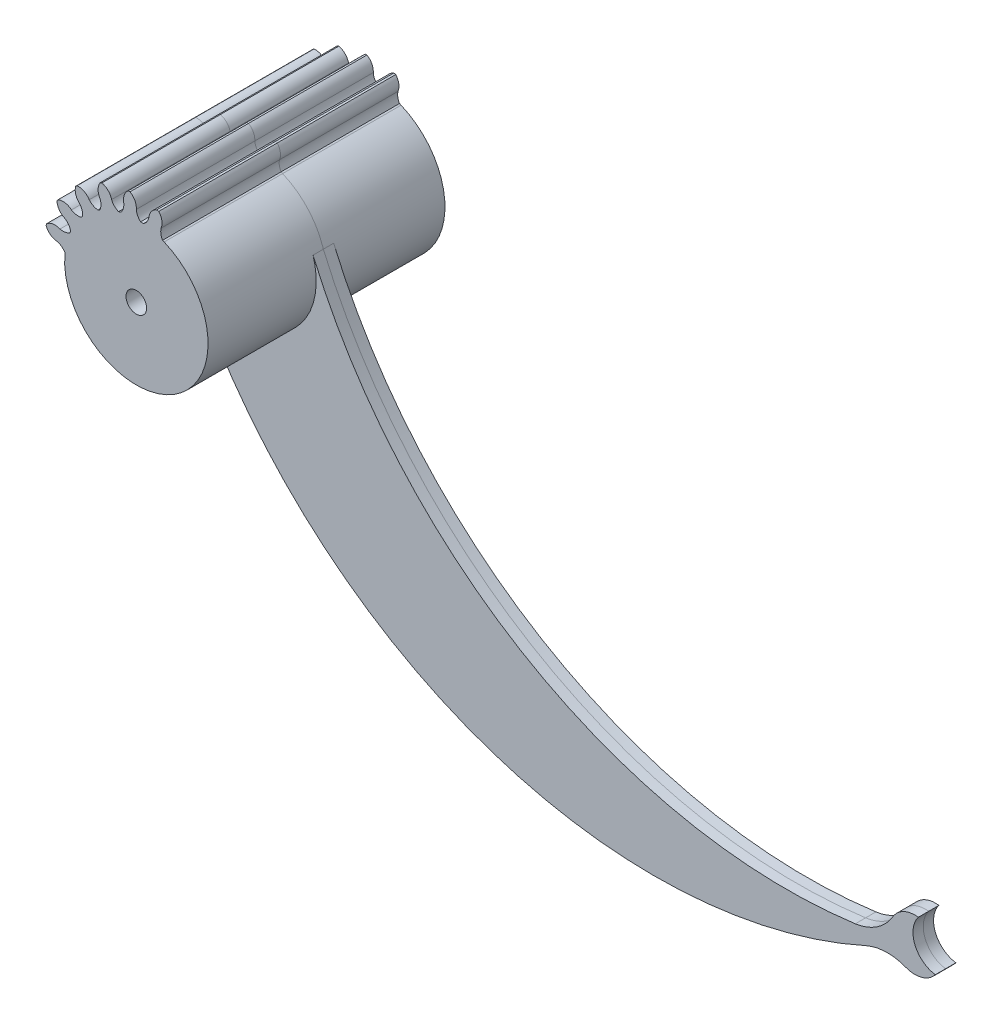
from build123d import *

# Parameters (mm, degrees)
ESQUISSE1_R             = 18
BOSS_EXTRU_1_DEPTH      = 23
ESQUISSE3_R             = 2
ENL_V_MAT_EXTRU_3_DEPTH = 35.307433597
BOSS_EXTRU_2_DEPTH      = 2
CONG_1_R                = 10
CONG_2_R                = 10


with BuildPart() as part:
    # Esquisse1 → Boss.-Extru.1 (new body)
    with BuildSketch(Plane.XY):
        Circle(ESQUISSE1_R)
    extrude(amount=-BOSS_EXTRU_1_DEPTH)

    # Esquisse3 → Enlèv. mat.-Extru.3 (cut, through all)
    with BuildSketch(Plane(origin=(0, 0, -23), x_dir=(-1, 0, 0), z_dir=(0, 0, -1))):
        with BuildLine():
            Line((-5.401914148, 12.832775649), (-5.100509092, 12.969438951))
            ThreePointArc((-5.100509092, 12.969438951), (-4.765685498, 13.881250232), (-4.803657598, 14.851850443))
            ThreePointArc((-4.803657598, 14.851850443), (-4.93702897, 16.32774427), (-4.211421318, 17.619852644))
            ThreePointArc((-4.211421318, 17.619852644), (-5.69322382, 17.602193117), (-6.904699682, 16.748743207))
            ThreePointArc((-6.904699682, 16.748743207), (-8.365662907, 16.50047527), (-9.429406277, 15.468728906))
            ThreePointArc((-9.429406277, 15.468728906), (-9.320405382, 15.468950409), (-9.211498437, 15.464420343))
            ThreePointArc((-9.211498437, 15.464420343), (-9.368945013, -15.369543563), (17.96620268, -1.102524947))
            ThreePointArc((17.96620268, -1.102524947), (18.020126749, -1.197253184), (18.069870351, -1.294241937))
            ThreePointArc((18.069870351, -1.294241937), (18.499584461, 0.123995101), (18.050898095, 1.536344583))
            ThreePointArc((18.050898095, 1.536344583), (18.254444436, 3.004206771), (17.591230084, 4.329422691))
            ThreePointArc((17.591230084, 4.329422691), (16.775166607, 3.092454254), (15.402187493, 2.534799463))
            ThreePointArc((15.402187493, 2.534799463), (14.540813003, 2.137466087), (13.889472301, 1.447832043))
            Line((13.889472301, 1.447832043), (13.889472301, 0.971270565))
            ThreePointArc((13.889472301, 0.971270565), (-7.29270091, -11.860747057), (-5.401914148, 12.832775649))
        make_face()
        with BuildLine():
            ThreePointArc((11.000443663, 11.074422202), (10.524374819, 10.215627293), (10.415766238, 9.239730569))
            ThreePointArc((10.415766238, 9.239730569), (10.462012349, 9.18733394), (10.507994882, 9.134705846))
            Line((10.507994882, 9.134705846), (10.731094032, 8.911606695))
            ThreePointArc((10.731094032, 8.911606695), (11.691932834, 8.886448288), (12.591250594, 9.225670511))
            ThreePointArc((12.591250594, 9.225670511), (13.950549833, 9.815887497), (15.405181444, 9.532872673))
            ThreePointArc((15.405181444, 9.532872673), (14.922963667, 10.934128013), (13.732171143, 11.816207192))
            ThreePointArc((13.732171143, 11.816207192), (13.037562859, 13.125241129), (11.723902757, 13.811060092))
            ThreePointArc((11.723902757, 13.811060092), (11.786796164, 12.33048759), (11.000443663, 11.074422202))
        make_face()
        with BuildLine():
            Line((12.765286048, 5.634000541), (12.874449055, 5.301826936))
            ThreePointArc((12.874449055, 5.301826936), (12.895585113, 5.250208748), (12.916514217, 5.198506303))
            ThreePointArc((12.916514217, 5.198506303), (13.838334104, 4.860248506), (14.81932063, 4.903093306))
            ThreePointArc((14.81932063, 4.903093306), (16.294287393, 5.046353769), (17.591230084, 4.329422691))
            ThreePointArc((17.591230084, 4.329422691), (17.563639265, 5.811073548), (16.702088682, 7.016802003))
            ThreePointArc((16.702088682, 7.016802003), (16.444034306, 8.476068412), (15.405181444, 9.532872673))
            ThreePointArc((15.405181444, 9.532872673), (15.009388539, 8.104797573), (13.874653946, 7.151682723))
            ThreePointArc((13.874653946, 7.151682723), (13.171881983, 6.501088333), (12.765286048, 5.634000541))
        make_face()
        with BuildLine():
            ThreePointArc((-2.431510322, 15.418830872), (-2.060789897, 14.584674949), (-1.415325051, 13.939210103))
            Line((-1.415325051, 13.939210103), (-0.828029009, 13.939210103))
            ThreePointArc((-0.828029009, 13.939210103), (-0.252520041, 14.694227343), (0, 15.609375))
            ThreePointArc((0, 15.609375), (0.327295419, 17.0546875), (1.415325051, 18.060789897))
            ThreePointArc((1.415325051, 18.060789897), (0, 18.5), (-1.415325051, 18.060789897))
            ThreePointArc((-1.415325051, 18.060789897), (-2.881790011, 18.274169922), (-4.211421318, 17.619852644))
            ThreePointArc((-4.211421318, 17.619852644), (-2.97995028, 16.795516793), (-2.431510322, 15.418830872))
        make_face()
        with BuildLine():
            ThreePointArc((9.141071212, 12.652802258), (10.252769067, 13.632689187), (11.723902757, 13.811060092))
            ThreePointArc((11.723902757, 13.811060092), (10.833862178, 14.995913787), (9.429406277, 15.468728906))
            ThreePointArc((9.429406277, 15.468728906), (8.365662907, 16.50047527), (6.904699682, 16.748743207))
            ThreePointArc((6.904699682, 16.748743207), (7.420174954, 15.359377971), (7.058528078, 13.922276009))
            ThreePointArc((7.058528078, 13.922276009), (6.869836592, 12.962423447), (7.063912165, 12.003645011))
            Line((7.063912165, 12.003645011), (7.465689298, 11.781332023))
            ThreePointArc((7.465689298, 11.781332023), (8.388832813, 12.052786521), (9.141071212, 12.652802258))
        make_face()
        with BuildLine():
            ThreePointArc((4.211421318, 17.619852644), (2.881790011, 18.274169922), (1.415325051, 18.060789897))
            ThreePointArc((1.415325051, 18.060789897), (2.333350053, 16.897484), (2.431510322, 15.418830872))
            ThreePointArc((2.431510322, 15.418830872), (2.537604324, 14.478038859), (2.985925197, 13.644160005))
            Line((2.985925197, 13.644160005), (3.460890209, 13.499921317))
            ThreePointArc((3.460890209, 13.499921317), (4.266125885, 14.042940985), (4.803657598, 14.851850443))
            ThreePointArc((4.803657598, 14.851850443), (5.559852448, 16.126299289), (6.904699682, 16.748743207))
            ThreePointArc((6.904699682, 16.748743207), (5.69322382, 17.602193117), (4.211421318, 17.619852644))
        make_face()
        Circle(ESQUISSE3_R)
    extrude(amount=-ENL_V_MAT_EXTRU_3_DEPTH, mode=Mode.SUBTRACT)


with BuildPart() as body_2:
    # Esquisse4 → Boss.-Extru.2 (new body)
    with BuildSketch(Plane(origin=(0, 0, -23), x_dir=(-1, 0, 0), z_dir=(0, 0, -1))):
        with BuildLine():
            ThreePointArc((12.644316935, -5.829413054), (-4.965169165, -13.007993792), (-13.312678081, 4.078407731))
            ThreePointArc((-13.312678081, 4.078407731), (-58.860226238, -45.189997217), (-125.296750737, -54.578451916))
            ThreePointArc((-125.296750737, -54.578451916), (-126.47076997, -50.089238619), (-130.829714456, -48.498339455))
            ThreePointArc((-130.829714456, -48.498339455), (-130.16877798, -53.454463241), (-134.130438845, -56.504912911))
            ThreePointArc((-134.130438845, -56.504912911), (-129.79196599, -58.440244295), (-125.793646659, -55.874840467))
            ThreePointArc((-125.793646659, -55.874840467), (-45.591937323, -61.233052926), (12.644316935, -5.829413054))
        make_face()
    extrude(amount=-BOSS_EXTRU_2_DEPTH)


with BuildPart() as body_3:
    # Symétrie1: mirrored copy
    add(part.part.mirror(Plane.XY.offset(-23)))


with BuildPart() as body_4:
    # Sym_trie1 2: mirrored copy
    add(body_2.part.mirror(Plane.XY.offset(-23)))

    # Congé2
    cong_2_edges = [body_4.edges().sort_by_distance(p)[0] for p in [
        (125.296750737, -54.578451916, -24),
        (125.793646659, -55.874840467, -24),
    ]]
    fillet(cong_2_edges, radius=CONG_2_R)


with BuildPart() as body_2_1:
    add(body_2.part)

    # Congé1
    cong_1_edges = [body_2_1.edges().sort_by_distance(p)[0] for p in [
        (125.296750737, -54.578451916, -22),
        (125.793646659, -55.874840467, -22),
    ]]
    fillet(cong_1_edges, radius=CONG_1_R)


solid = Compound([part.part, body_3.part, body_4.part, body_2_1.part])
